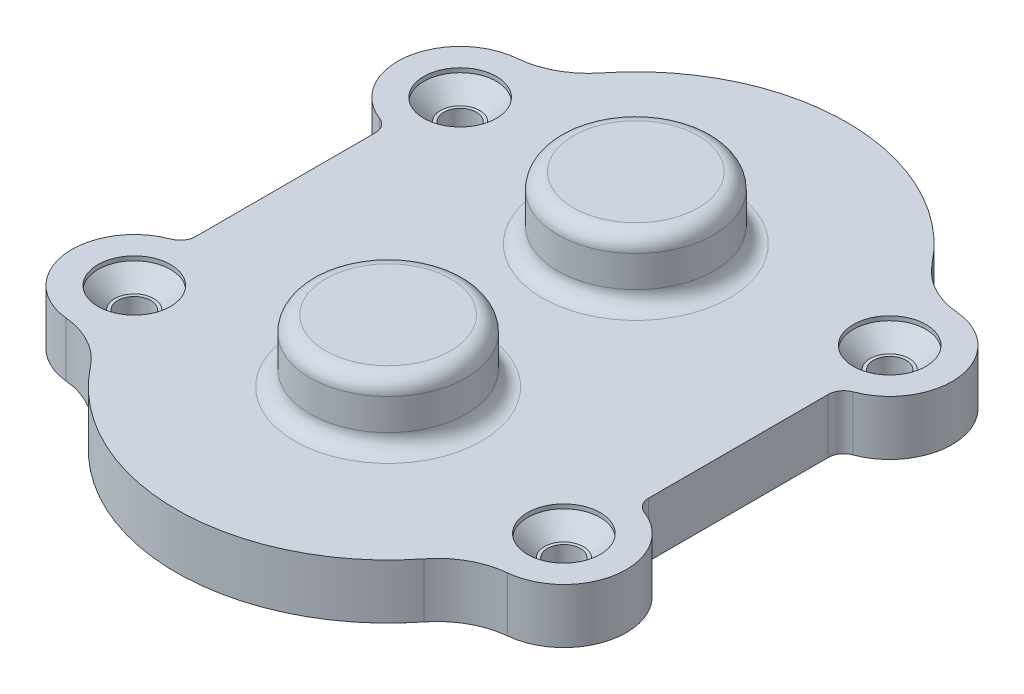
from build123d import *

# Parameters (mm, degrees)
BOSS_EXTRUDE1_DEPTH       = 7
FILLET1_R                 = 2
FILLET2_R                 = 10
SKETCH2_R                 = 10
BOSS_EXTRUDE2_DEPTH       = 8
FILLET3_R                 = 2
M10_CLEARANCE_HOLE1_D     = 10
M10_CLEARANCE_HOLE1_DEPTH = 10
M10_CLEARANCE_HOLE1_TIP   = 3.004303095
M5X0_8_TAPPED_HOLE1_D     = 4.2
M5X0_8_TAPPED_HOLE1_DEPTH = 12.4
M5X0_8_TAPPED_HOLE1_TIP   = 1.2618073
SKETCH6_R                 = 4.65
CUT_EXTRUDE1_DEPTH        = 0.55
SKETCH8_R                 = 4.65
CUT_EXTRUDE2_DEPTH        = 0.55
SKETCH9_R                 = 2.5
SKETCH10_R                = 4.65
CUT_EXTRUDE3_DEPTH        = 0.55
SKETCH11_R                = 2.5
SKETCH12_R                = 4.65
CUT_EXTRUDE4_DEPTH        = 0.55
SKETCH13_R                = 2.5


with BuildPart() as part:
    # Sketch1 → Boss-Extrude1 (new body)
    with BuildSketch(Plane(origin=(0, 0, 0), x_dir=(1, 0, 0), z_dir=(0, 1, 0))):
        with BuildLine():
            Line((-29, 35.312691864), (-29, 61.312691864))
            ThreePointArc((-29, 61.312691864), (-35.104593263, 71.654789625), (-24.072111437, 76.399195782))
            ThreePointArc((-24.072111437, 76.399195782), (0, 91.170808686), (24.072111437, 76.399195782))
            ThreePointArc((24.072111437, 76.399195782), (35.104593263, 71.654789625), (29, 61.312691864))
            Line((29, 61.312691864), (29, 35.312691864))
            ThreePointArc((29, 35.312691864), (35.126764687, 25.039526301), (24.203518415, 20.16532205))
            ThreePointArc((24.203518415, 20.16532205), (0, 5.30985101), (-24.203518415, 20.16532205))
            ThreePointArc((-24.203518415, 20.16532205), (-35.126764687, 25.039526301), (-29, 35.312691864))
        make_face()
    extrude(amount=BOSS_EXTRUDE1_DEPTH)

    # Fillet1
    fillet1_edges = [part.edges().sort_by_distance(p)[0] for p in [
        (29, 3.5, -61.312691864),
        (29, 3.5, -35.312691864),
        (-29, 3.5, -35.312691864),
        (-29, 3.5, -61.312691864),
    ]]
    fillet(fillet1_edges, radius=FILLET1_R)

    # Fillet2
    fillet2_edges = [part.edges().sort_by_distance(p)[0] for p in [
        (24.072111437, 3.5, -76.399195782),
        (24.203518415, 3.5, -20.16532205),
        (-24.203518415, 3.5, -20.16532205),
        (-24.072111437, 3.5, -76.399195782),
    ]]
    fillet(fillet2_edges, radius=FILLET2_R)

    # Sketch2 → Boss-Extrude2 (add)
    with BuildSketch(Plane(origin=(0, 7, 0), x_dir=(1, 0, 0), z_dir=(0, 1, 0))):
        with Locations(Location((0, 64.170808686, 0), (0, 0, 270))):
            Circle(SKETCH2_R)
        with Locations(Location((0, 32.454575041, 0), (0, 0, 270))):
            Circle(SKETCH2_R)
    extrude(amount=BOSS_EXTRUDE2_DEPTH)

    # Fillet3
    fillet3_edges = [part.edges().sort_by_distance(p)[0] for p in [
        (0, 7, -74.170808686),
        (0, 15, -74.170808686),
        (0, 7, -42.454575041),
        (0, 15, -42.454575041),
    ]]
    fillet(fillet3_edges, radius=FILLET3_R)

    # M10 Clearance Hole1
    with Locations(Plane(origin=(0, 0, -32.454575041), x_dir=(0, 0, -1), z_dir=(0, -1, 0))):
        with Locations((0, 0), (31.716233645, 0)):
            Hole(M10_CLEARANCE_HOLE1_D / 2, depth=M10_CLEARANCE_HOLE1_DEPTH)
            with Locations((0, 0, -(M10_CLEARANCE_HOLE1_DEPTH + M10_CLEARANCE_HOLE1_TIP / 2))):  # 118° drill point
                Cone(0, M10_CLEARANCE_HOLE1_D / 2, M10_CLEARANCE_HOLE1_TIP, mode=Mode.SUBTRACT)

    # M5x0.8 Tapped Hole1
    with Locations(Plane(origin=(-27.5, 7, -69.170808686), x_dir=(0, 0, 1), z_dir=(0, 1, 0))):
        with Locations((0, 0), (0, 55), (41.716233645, 55), (41.716233645, 0)):
            Hole(M5X0_8_TAPPED_HOLE1_D / 2, depth=M5X0_8_TAPPED_HOLE1_DEPTH)
            with Locations((0, 0, -(M5X0_8_TAPPED_HOLE1_DEPTH + M5X0_8_TAPPED_HOLE1_TIP / 2))):  # 118° drill point
                Cone(0, M5X0_8_TAPPED_HOLE1_D / 2, M5X0_8_TAPPED_HOLE1_TIP, mode=Mode.SUBTRACT)

    # Sketch6 → Cut-Extrude1 (cut)
    with BuildSketch(Plane(origin=(0, 7, 0), x_dir=(1, 0, 0), z_dir=(0, 1, 0))):
        with Locations(Location((27.5, 69.170808686, 0), (0, 0, 270))):
            Circle(SKETCH6_R)
    extrude(amount=-CUT_EXTRUDE1_DEPTH, mode=Mode.SUBTRACT)

    # Cut-Loft1: read off the stored shape, not the designer's step
    # Cut-Loft1: loft between two sections, ruled curve by curve
    cut_loft1_from = [
        Edge.make_bspline([(25.414803916, 4.3, -70.549923363), (22.656574563, 4.3, -66.379531195), (26.826966731, 4.3, -63.621301842), (29.585196084, 4.3, -67.79169401), (32.343425437, 4.3, -71.962086178), (28.173033269, 4.3, -74.720315531), (25.414803916, 4.3, -70.549923363)], [0, 0, 0, 0, 0.5, 0.5, 0.5, 1, 1, 1, 1], 3, [1, 0.333333333, 0.333333333, 1, 0.333333333, 0.333333333, 1]),
    ]
    cut_loft1_to = [
        Edge.make_bspline([(23.222066223, 6.45, -70.993384502), (19.576914593, 6.45, -62.437516949), (28.132782146, 6.45, -58.792365318), (31.777933777, 6.45, -67.348232871), (35.423085407, 6.45, -75.904100424), (26.867217854, 6.45, -79.549252055), (23.222066223, 6.45, -70.993384502)], [0, 0, 0, 0, 0.5, 0.5, 0.5, 1, 1, 1, 1], 3, [1, 0.333333333, 0.333333333, 1, 0.333333333, 0.333333333, 1]),
    ]
    cut_loft1 = Solid(Shell([*[Face.make_surface_from_curves(cut_loft1_from[k], cut_loft1_to[k]) for k in range(1)], Face(Wire(cut_loft1_from)), Face(Wire(cut_loft1_to))]))
    add(cut_loft1, mode=Mode.SUBTRACT)

    # Sketch8 → Cut-Extrude2 (cut)
    with BuildSketch(Plane(origin=(0, 7, 0), x_dir=(1, 0, 0), z_dir=(0, 1, 0))):
        with Locations(Location((-27.5, 69.170808686, 0), (0, 0, 270))):
            Circle(SKETCH8_R)
    extrude(amount=-CUT_EXTRUDE2_DEPTH, mode=Mode.SUBTRACT)

    # Sketch9 → section 0 of cut_loft2
    with BuildSketch(Plane(origin=(0, 4.3, 0), x_dir=(1, 0, 0), z_dir=(0, 1, 0)), mode=Mode.PRIVATE) as cut_loft2_s0:
        with Locations((-27.5, 69.170808686)):
            Circle(SKETCH9_R)
    # loft up to a face of the part (cut_loft2)
    loft([cut_loft2_s0.sketch, Face(Wire([part.edges().sort_by_distance((-24.110295882, 6.45, -72.353952729))[0]]))], mode=Mode.SUBTRACT)

    # Sketch10 → Cut-Extrude3 (cut)
    with BuildSketch(Plane(origin=(0, 7, 0), x_dir=(1, 0, 0), z_dir=(0, 1, 0))):
        with Locations(Location((-27.5, 27.454575041, 0), (0, 0, 270))):
            Circle(SKETCH10_R)
    extrude(amount=-CUT_EXTRUDE3_DEPTH, mode=Mode.SUBTRACT)

    # Sketch11 → section 0 of cut_loft3
    with BuildSketch(Plane(origin=(0, 4.3, 0), x_dir=(1, 0, 0), z_dir=(0, 1, 0)), mode=Mode.PRIVATE) as cut_loft3_s0:
        with Locations((-27.5, 27.454575041)):
            Circle(SKETCH11_R)
    # loft up to a face of the part (cut_loft3)
    loft([cut_loft3_s0.sketch, Face(Wire([part.edges().sort_by_distance((-24.110295882, 6.45, -30.637719083))[0]]))], mode=Mode.SUBTRACT)

    # Sketch12 → Cut-Extrude4 (cut)
    with BuildSketch(Plane(origin=(0, 7, 0), x_dir=(1, 0, 0), z_dir=(0, 1, 0))):
        with Locations(Location((27.5, 27.454575041, 0), (0, 0, 270))):
            Circle(SKETCH12_R)
    extrude(amount=-CUT_EXTRUDE4_DEPTH, mode=Mode.SUBTRACT)

    # Sketch13 → section 0 of cut_loft4
    with BuildSketch(Plane(origin=(0, 4.3, 0), x_dir=(1, 0, 0), z_dir=(0, 1, 0)), mode=Mode.PRIVATE) as cut_loft4_s0:
        with Locations((27.5, 27.454575041)):
            Circle(SKETCH13_R)
    # loft up to a face of the part (cut_loft4)
    loft([cut_loft4_s0.sketch, Face(Wire([part.edges().sort_by_distance((30.889704118, 6.45, -30.637719083))[0]]))], mode=Mode.SUBTRACT)


solid = part.part
